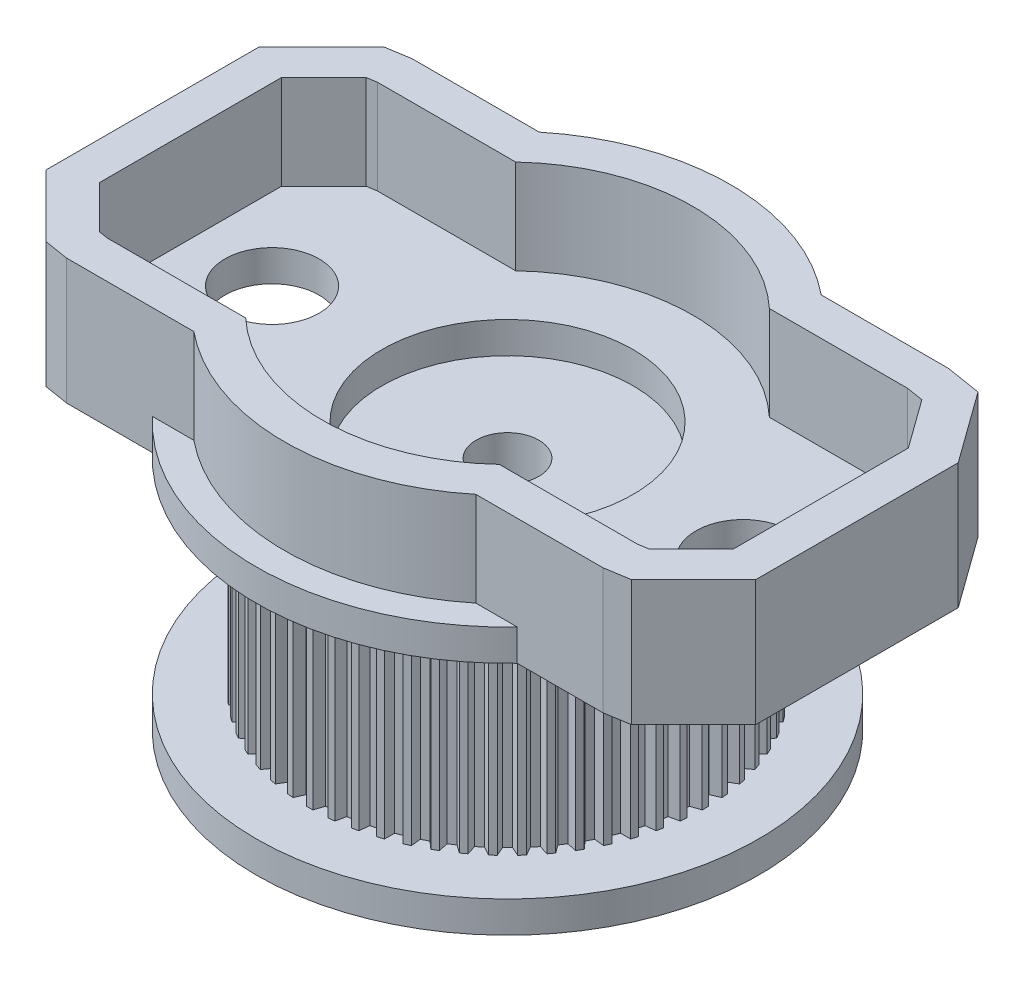
from build123d import *

# Parameters (mm, degrees)
BOSS_EXTRUDE1_DEPTH = 4
SKETCH2_R           = 8
SKETCH2_R_2         = 5
BOSS_EXTRUDE2_DEPTH = 1
SKETCH4_R           = 6
BOSS_EXTRUDE3_DEPTH = 6.5
BOSS_EXTRUDE4_DEPTH = 6.5
CIRPATTERN1_COUNT   = 60
SKETCH6_R           = 8
BOSS_EXTRUDE5_DEPTH = 1
CUT_EXTRUDE3_DEPTH  = 4
SKETCH14_R          = 1
CUT_EXTRUDE4_DEPTH  = 10
SKETCH15_R          = 3
CUT_EXTRUDE5_DEPTH  = 5.5
CHAMFER1_SIZE       = 0.5
BOSS_EXTRUDE6_DEPTH = 3
SKETCH17_R          = 4
CUT_EXTRUDE6_DEPTH  = 1
BOSS_EXTRUDE7_DEPTH = 1
CUT_EXTRUDE7_START  = -1
CUT_EXTRUDE7_DEPTH  = 1


# Read off the part's stored shape, not the designer's step: Cut-Extrude7
with BuildPart() as part:
    # Sketch1 → Boss-Extrude1 (new body)
    with BuildSketch(Plane(origin=(0, 0, 0), x_dir=(1, 0, 0), z_dir=(0, 1, 0))):
        Polygon((1.95, 3.377499075), (-1.95, 3.377499075), (-3.9, 0), (-1.95, -3.377499075), (1.95, -3.377499075), (3.9, 0), align=None)
    extrude(amount=BOSS_EXTRUDE1_DEPTH)

    # Sketch12 → Cut-Extrude3 (cut)
    with BuildSketch(Plane.XZ):
        Polygon((1.95, -3.377499075), (3.9, 0), (1.95, 3.377499075), (-1.95, 3.377499075), (-3.9, 0), (-1.95, -3.377499075), align=None)
    extrude(amount=-CUT_EXTRUDE3_DEPTH, mode=Mode.SUBTRACT)


with BuildPart() as body_2:
    # Sketch2 → Boss-Extrude2 (new body)
    # profile 1 of 3: a face of its own
    with BuildSketch(Plane(origin=(0, 4, 0), x_dir=(1, 0, 0), z_dir=(0, 1, 0))):
        with Locations(Location((0, 0, 0), (0, 0, 270))):
            Circle(SKETCH2_R)
        Circle(SKETCH2_R_2, mode=Mode.SUBTRACT)
    # profile 2 of 3: a face of its own
    with BuildSketch(Plane(origin=(0, 4, 0), x_dir=(1, 0, 0), z_dir=(0, 1, 0))):
        Circle(SKETCH2_R_2)
        Polygon((3.9, 0), (1.95, 3.377499075), (-1.95, 3.377499075), (-3.9, 0), (-1.95, -3.377499075), (1.95, -3.377499075), align=None, mode=Mode.SUBTRACT)
    # profile 3 of 3: a face of its own
    with BuildSketch(Plane(origin=(0, 4, 0), x_dir=(1, 0, 0), z_dir=(0, 1, 0))):
        Polygon((1.95, -3.377499075), (3.9, 0), (1.95, 3.377499075), (-1.95, 3.377499075), (-3.9, 0), (-1.95, -3.377499075), align=None)
    extrude(amount=BOSS_EXTRUDE2_DEPTH)

    # Sketch4 → Boss-Extrude3 (add)
    with BuildSketch(Plane(origin=(0, 5, 0), x_dir=(1, 0, 0), z_dir=(0, 1, 0))):
        with Locations(Location((0, 0, 0), (0, 0, 90))):
            Circle(SKETCH4_R)
    extrude(amount=BOSS_EXTRUDE3_DEPTH)

    # Sketch5 → Boss-Extrude4 (add)
    with BuildSketch(Plane(origin=(0, 11.5, 0), x_dir=(1, 0, 0), z_dir=(0, 1, 0))):
        with BuildLine():
            Line((-0.2, 5.99666574), (-0.1, 6.3))
            Line((-0.1, 6.3), (0.1, 6.3))
            Line((0.1, 6.3), (0.2, 5.99666574))
            ThreePointArc((0.2, 5.99666574), (0, 6), (-0.2, 5.99666574))
        make_face()
    boss_extrude4 = extrude(amount=-BOSS_EXTRUDE4_DEPTH)

    # CirPattern1: Boss-Extrude4 ×60 about axis
    cirpattern1_axis = Axis((0, 0, 0), (0, 1, 0))
    for i in range(1, CIRPATTERN1_COUNT):
        add(boss_extrude4.rotate(cirpattern1_axis, i * 360 / CIRPATTERN1_COUNT))

    # Sketch6 → Boss-Extrude5 (add)
    with BuildSketch(Plane(origin=(0, 11.5, 0), x_dir=(1, 0, 0), z_dir=(0, 1, 0))):
        with Locations(Location((0, 0, 0), (0, 0, 270))):
            Circle(SKETCH6_R)
    extrude(amount=BOSS_EXTRUDE5_DEPTH)

    # Sketch14 → Cut-Extrude4 (cut)
    with BuildSketch(Plane.XZ.offset(-4)):
        with Locations(Location((0, 0, 0), (0, 0, 270))):
            Circle(SKETCH14_R)
    extrude(amount=-CUT_EXTRUDE4_DEPTH, mode=Mode.SUBTRACT)

    # Sketch15 → Cut-Extrude5 (cut)
    with BuildSketch(Plane.XZ.offset(-4)):
        with Locations(Location((0, 0, 0), (0, 0, 270))):
            Circle(SKETCH15_R)
    extrude(amount=-CUT_EXTRUDE5_DEPTH, mode=Mode.SUBTRACT)

    # Chamfer1
    chamfer1_edges = [body_2.edges().sort_by_distance(p)[0] for p in [
        (0, 4, 3),
    ]]
    chamfer(chamfer1_edges, length=CHAMFER1_SIZE)

    # Sketch16 → Boss-Extrude6 (add)
    with BuildSketch(Plane(origin=(0, 12.5, 0), x_dir=(1, 0, 0), z_dir=(0, 1, 0))):
        with BuildLine():
            Line((-4.039801975, -4.3), (-6.74610999, -4.3))
            ThreePointArc((-6.74610999, -4.3), (-6.306399823, -4.922328846), (-5.809475019, -5.5))
            Line((-5.809475019, -5.5), (-4.489988864, -5.5))
            ThreePointArc((-4.489988864, -5.5), (0, -7.1), (4.489988864, -5.5))
            Line((4.489988864, -5.5), (5.809475019, -5.5))
            ThreePointArc((5.809475019, -5.5), (6.306399823, -4.922328846), (6.74610999, -4.3))
            Line((6.74610999, -4.3), (4.039801975, -4.3))
            ThreePointArc((4.039801975, -4.3), (0, -5.9), (-4.039801975, -4.3))
        make_face()
        with BuildLine():
            Line((8.539610806, 5.5), (5.809475019, 5.5))
            ThreePointArc((5.809475019, 5.5), (6.306399823, 4.922328846), (6.74610999, 4.3))
            Line((6.74610999, 4.3), (8.443269032, 4.3))
            Line((8.443269032, 4.3), (8.983343526, 4.212717852))
            Line((8.983343526, 4.212717852), (10.1, 2.665558624))
            Line((10.1, 2.665558624), (10.1, -2.901108515))
            Line((10.1, -2.901108515), (8.750810733, -4.250297782))
            Line((8.750810733, -4.250297782), (8.443269032, -4.3))
            Line((8.443269032, -4.3), (6.74610999, -4.3))
            ThreePointArc((6.74610999, -4.3), (6.306399823, -4.922328846), (5.809475019, -5.5))
            Line((5.809475019, -5.5), (8.539610806, -5.5))
            Line((8.539610806, -5.5), (9.325110413, -5.373054377))
            Line((9.325110413, -5.373054377), (11.3, -3.39816479))
            Line((11.3, -3.39816479), (11.3, 3.053376229))
            Line((11.3, 3.053376229), (9.665482667, 5.31804637))
            Line((9.665482667, 5.31804637), (8.539610806, 5.5))
        make_face()
        with BuildLine():
            ThreePointArc((-5.809475019, 5.5), (-6.306399823, 4.922328846), (-6.74610999, 4.3))
            Line((-6.74610999, 4.3), (-4.039801975, 4.3))
            ThreePointArc((-4.039801975, 4.3), (0, 5.9), (4.039801975, 4.3))
            Line((4.039801975, 4.3), (6.74610999, 4.3))
            ThreePointArc((6.74610999, 4.3), (6.306399823, 4.922328846), (5.809475019, 5.5))
            Line((5.809475019, 5.5), (4.489988864, 5.5))
            ThreePointArc((4.489988864, 5.5), (0, 7.1), (-4.489988864, 5.5))
            Line((-4.489988864, 5.5), (-5.809475019, 5.5))
        make_face()
        with BuildLine():
            Line((-8.443269032, 4.3), (-6.74610999, 4.3))
            ThreePointArc((-6.74610999, 4.3), (-6.306399823, 4.922328846), (-5.809475019, 5.5))
            Line((-5.809475019, 5.5), (-8.539610806, 5.5))
            Line((-8.539610806, 5.5), (-9.325110413, 5.373054377))
            Line((-9.325110413, 5.373054377), (-11.3, 3.39816479))
            Line((-11.3, 3.39816479), (-11.3, -3.39816479))
            Line((-11.3, -3.39816479), (-9.325110413, -5.373054377))
            Line((-9.325110413, -5.373054377), (-8.539610806, -5.5))
            Line((-8.539610806, -5.5), (-5.809475019, -5.5))
            ThreePointArc((-5.809475019, -5.5), (-6.306399823, -4.922328846), (-6.74610999, -4.3))
            Line((-6.74610999, -4.3), (-8.443269032, -4.3))
            Line((-8.443269032, -4.3), (-8.750810733, -4.250297782))
            Line((-8.750810733, -4.250297782), (-10.1, -2.901108515))
            Line((-10.1, -2.901108515), (-10.1, 2.901108515))
            Line((-10.1, 2.901108515), (-8.750810733, 4.250297782))
            Line((-8.750810733, 4.250297782), (-8.443269032, 4.3))
        make_face()
    extrude(amount=BOSS_EXTRUDE6_DEPTH)

    # Sketch17 → Cut-Extrude6 (cut)
    with BuildSketch(Plane(origin=(0, 12.5, 0), x_dir=(1, 0, 0), z_dir=(0, 1, 0))):
        with Locations(Location((0, 0, 0), (0, 0, 270))):
            Circle(SKETCH17_R)
    extrude(amount=-CUT_EXTRUDE6_DEPTH, mode=Mode.SUBTRACT)

    # Sketch16<4> → Boss-Extrude7 (add)
    with BuildSketch(Plane(origin=(0, 12.5, 0), x_dir=(1, 0, 0), z_dir=(0, 1, 0))):
        with BuildLine():
            Line((-6.92820323, 4), (-8.419183588, 4))
            Line((-8.419183588, 4), (-8.607235813, 3.969608633))
            Line((-8.607235813, 3.969608633), (-9.8, 2.776844446))
            Line((-9.8, 2.776844446), (-9.8, -2.776844446))
            Line((-9.8, -2.776844446), (-8.607235813, -3.969608633))
            Line((-8.607235813, -3.969608633), (-8.419183588, -4))
            Line((-8.419183588, -4), (-6.92820323, -4))
            ThreePointArc((-6.92820323, -4), (-7.506127018, -2.767319496), (-7.866666667, -1.454494949))
            ThreePointArc((-7.866666667, -1.454494949), (-9, 0), (-7.866666667, 1.454494949))
            ThreePointArc((-7.866666667, 1.454494949), (-7.506127018, 2.767319496), (-6.92820323, 4))
        make_face()
        with BuildLine():
            Line((8.419183588, 4), (6.92820323, 4))
            ThreePointArc((6.92820323, 4), (7.506127018, 2.767319496), (7.866666667, 1.454494949))
            ThreePointArc((7.866666667, 1.454494949), (8.683215957, 0.921954446), (9, 0))
            ThreePointArc((9, 0), (8.683215957, -0.921954446), (7.866666667, -1.454494949))
            ThreePointArc((7.866666667, -1.454494949), (7.506127018, -2.767319496), (6.92820323, -4))
            Line((6.92820323, -4), (8.419183588, -4))
            Line((8.419183588, -4), (8.607235813, -3.969608633))
            Line((8.607235813, -3.969608633), (9.8, -2.776844446))
            Line((9.8, -2.776844446), (9.8, 2.568604223))
            Line((9.8, 2.568604223), (8.812808741, 3.936385722))
            Line((8.812808741, 3.936385722), (8.419183588, 4))
        make_face()
        with BuildLine():
            ThreePointArc((6.74610999, 4.3), (6.838801833, 4.150998613), (6.92820323, 4))
            Line((6.92820323, 4), (8.419183588, 4))
            Line((8.419183588, 4), (8.812808741, 3.936385722))
            Line((8.812808741, 3.936385722), (9.8, 2.568604223))
            Line((9.8, 2.568604223), (9.8, -2.776844446))
            Line((9.8, -2.776844446), (8.607235813, -3.969608633))
            Line((8.607235813, -3.969608633), (8.419183588, -4))
            Line((8.419183588, -4), (6.92820323, -4))
            ThreePointArc((6.92820323, -4), (6.838801833, -4.150998613), (6.74610999, -4.3))
            Line((6.74610999, -4.3), (8.443269032, -4.3))
            Line((8.443269032, -4.3), (8.750810733, -4.250297782))
            Line((8.750810733, -4.250297782), (10.1, -2.901108515))
            Line((10.1, -2.901108515), (10.1, 2.665558624))
            Line((10.1, 2.665558624), (8.983343526, 4.212717852))
            Line((8.983343526, 4.212717852), (8.443269032, 4.3))
            Line((8.443269032, 4.3), (6.74610999, 4.3))
        make_face()
        with BuildLine():
            Line((8.539610806, 5.5), (5.809475019, 5.5))
            ThreePointArc((5.809475019, 5.5), (6.306399823, 4.922328846), (6.74610999, 4.3))
            Line((6.74610999, 4.3), (8.443269032, 4.3))
            Line((8.443269032, 4.3), (8.983343526, 4.212717852))
            Line((8.983343526, 4.212717852), (10.1, 2.665558624))
            Line((10.1, 2.665558624), (10.1, -2.901108515))
            Line((10.1, -2.901108515), (8.750810733, -4.250297782))
            Line((8.750810733, -4.250297782), (8.443269032, -4.3))
            Line((8.443269032, -4.3), (6.74610999, -4.3))
            ThreePointArc((6.74610999, -4.3), (6.306399823, -4.922328846), (5.809475019, -5.5))
            Line((5.809475019, -5.5), (8.539610806, -5.5))
            Line((8.539610806, -5.5), (9.325110413, -5.373054377))
            Line((9.325110413, -5.373054377), (11.3, -3.39816479))
            Line((11.3, -3.39816479), (11.3, 3.053376229))
            Line((11.3, 3.053376229), (9.665482667, 5.31804637))
            Line((9.665482667, 5.31804637), (8.539610806, 5.5))
        make_face()
        with BuildLine():
            Line((-8.443269032, 4.3), (-6.74610999, 4.3))
            ThreePointArc((-6.74610999, 4.3), (-6.306399823, 4.922328846), (-5.809475019, 5.5))
            Line((-5.809475019, 5.5), (-8.539610806, 5.5))
            Line((-8.539610806, 5.5), (-9.325110413, 5.373054377))
            Line((-9.325110413, 5.373054377), (-11.3, 3.39816479))
            Line((-11.3, 3.39816479), (-11.3, -3.39816479))
            Line((-11.3, -3.39816479), (-9.325110413, -5.373054377))
            Line((-9.325110413, -5.373054377), (-8.539610806, -5.5))
            Line((-8.539610806, -5.5), (-5.809475019, -5.5))
            ThreePointArc((-5.809475019, -5.5), (-6.306399823, -4.922328846), (-6.74610999, -4.3))
            Line((-6.74610999, -4.3), (-8.443269032, -4.3))
            Line((-8.443269032, -4.3), (-8.750810733, -4.250297782))
            Line((-8.750810733, -4.250297782), (-10.1, -2.901108515))
            Line((-10.1, -2.901108515), (-10.1, 2.901108515))
            Line((-10.1, 2.901108515), (-8.750810733, 4.250297782))
            Line((-8.750810733, 4.250297782), (-8.443269032, 4.3))
        make_face()
        with BuildLine():
            Line((-8.607235813, 3.969608633), (-8.419183588, 4))
            Line((-8.419183588, 4), (-6.92820323, 4))
            ThreePointArc((-6.92820323, 4), (-6.838801833, 4.150998613), (-6.74610999, 4.3))
            Line((-6.74610999, 4.3), (-8.443269032, 4.3))
            Line((-8.443269032, 4.3), (-8.750810733, 4.250297782))
            Line((-8.750810733, 4.250297782), (-10.1, 2.901108515))
            Line((-10.1, 2.901108515), (-10.1, -2.901108515))
            Line((-10.1, -2.901108515), (-8.750810733, -4.250297782))
            Line((-8.750810733, -4.250297782), (-8.443269032, -4.3))
            Line((-8.443269032, -4.3), (-6.74610999, -4.3))
            ThreePointArc((-6.74610999, -4.3), (-6.838801833, -4.150998613), (-6.92820323, -4))
            Line((-6.92820323, -4), (-8.419183588, -4))
            Line((-8.419183588, -4), (-8.607235813, -3.969608633))
            Line((-8.607235813, -3.969608633), (-9.8, -2.776844446))
            Line((-9.8, -2.776844446), (-9.8, 2.776844446))
            Line((-9.8, 2.776844446), (-8.607235813, 3.969608633))
        make_face()
    extrude(amount=-BOSS_EXTRUDE7_DEPTH)

    # Cut-Extrude7 outline → Cut-Extrude7 (cut)
    with BuildSketch(Plane(origin=(0, 12.5, 0), x_dir=(1, 0, 0), z_dir=(0, 1, 0)).offset(CUT_EXTRUDE7_START)):
        with BuildLine():
            ThreePointArc((7.866666667, -1.454494949), (8, 0), (7.866666667, 1.454494949))
            ThreePointArc((7.866666667, 1.454494949), (6, 0), (7.866666667, -1.454494949))
        make_face()
        with BuildLine():
            ThreePointArc((-7.866666667, -1.454494949), (-6, 0), (-7.866666667, 1.454494949))
            ThreePointArc((-7.866666667, 1.454494949), (-8, 0), (-7.866666667, -1.454494949))
        make_face()
    extrude(amount=CUT_EXTRUDE7_DEPTH, mode=Mode.SUBTRACT)


solid = body_2.part
